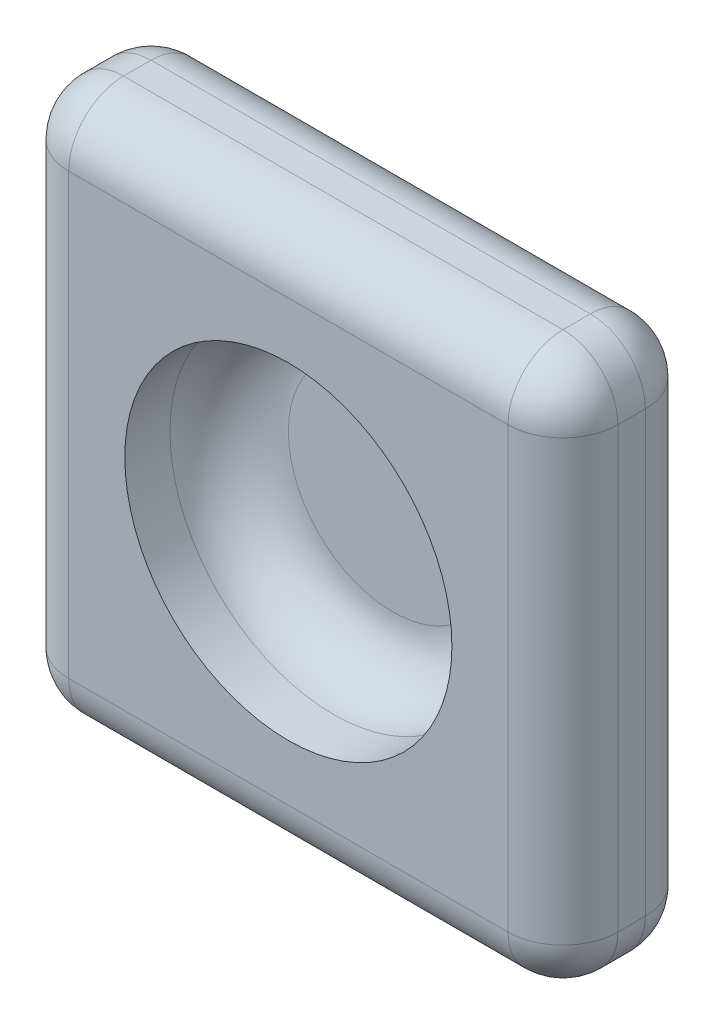
from build123d import *

# Parameters (mm, degrees)
SKETCH1_W           = 100
SKETCH1_H           = 100
BOSS_EXTRUDE1_DEPTH = 25
FILLET2_R           = 10
CUT_EXTRUDE1_START  = -2
SKETCH5_R           = 4
CUT_EXTRUDE1_DEPTH  = 3


with BuildPart() as part:
    # Sketch1 → Boss-Extrude1 (new body)
    with BuildSketch(Plane(origin=(0, 0, 0), x_dir=(0, 1, 0), z_dir=(0, 0, 1))):
        Rectangle(SKETCH1_W, SKETCH1_H)
    extrude(amount=BOSS_EXTRUDE1_DEPTH)

    # Sketch4 → Cut-Revolve2 (revolve, cut)
    with BuildSketch(Plane(origin=(0, 0, 0), x_dir=(0, -1, 0), z_dir=(-1, 0, 0))):
        with BuildLine():
            Line((0, 25), (0, 6))
            Line((0, 6), (-19, 6))
            ThreePointArc((-19, 6), (-26.625968884, 9.158779738), (-29.784748623, 16.784748623))
            Line((-29.784748623, 16.784748623), (-29.784748623, 25))
            Line((-29.784748623, 25), (0, 25))
        make_face()
    revolve(axis=Axis((0, 0, 0), (0, 0, 1)), mode=Mode.SUBTRACT)

    # Fillet2
    fillet2_edges = [part.edges().sort_by_distance(p)[0] for p in [
        (0, -50, 25),
        (0, -50, 0),
        (50, -50, 12.5),
        (50, 0, 25),
        (50, 0, 0),
        (-50, 0, 25),
        (-50, -50, 12.5),
        (-50, 0, 0),
        (50, 50, 12.5),
        (0, 50, 25),
        (-50, 50, 12.5),
        (0, 50, 0),
    ]]
    fillet(fillet2_edges, radius=FILLET2_R)

    # Sketch5 → Cut-Extrude1 (cut)
    with BuildSketch(Plane(origin=(0, 0, 0), x_dir=(1, 0, 0), z_dir=(0, 0, -1)).offset(CUT_EXTRUDE1_START)):
        Circle(SKETCH5_R)
    extrude(amount=-CUT_EXTRUDE1_DEPTH, mode=Mode.SUBTRACT)


solid = part.part
